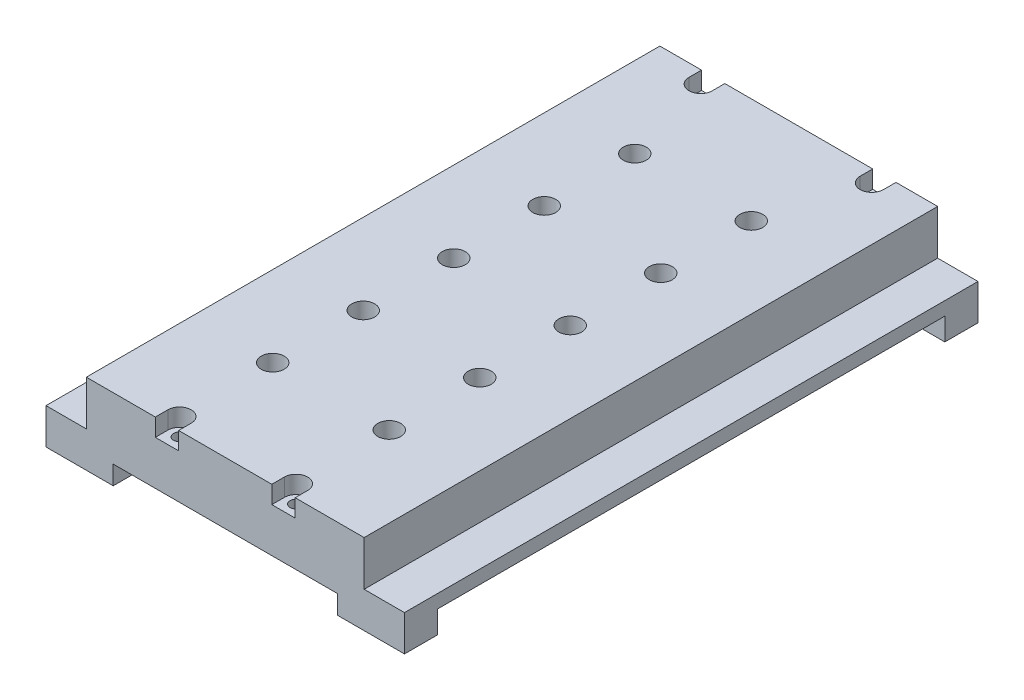
from build123d import *

# Parameters (mm, degrees)
SKETCH1_W                    = 101.6
SKETCH1_H                    = 162.56
BOSS_EXTRUDE1_DEPTH          = 22.86
SKETCH2_W                    = 75
SKETCH2_H                    = 150.368
CUT_EXTRUDE1_DEPTH           = 10.7
SKETCH3_W                    = 72
SKETCH3_H                    = 11.000000098
LPATTERN1_COUNT              = 6
LPATTERN1_PITCH              = 25.622799961
M3_CLEARANCE_HOLE1_D         = 3.4
SKETCH10_R                   = 3.249999977
CUT_EXTRUDE2_DEPTH           = 5
SKETCH11_W                   = 11.43
SKETCH11_H                   = 162.56
CUT_EXTRUDE3_DEPTH           = 12.7
SKETCH12_W                   = 15.748
SKETCH12_H                   = 143.764
CUT_EXTRUDE4_DEPTH           = 6.35
SKETCH17_W                   = 63.5
SKETCH17_H                   = 6.096
CUT_EXTRUDE6_DEPTH           = 5.334
M3_START                     = 5.334
M3_CLEARANCE_HOLE2_OUTLINE_R = 1.7
M3_CLEARANCE_HOLE2_DEPTH     = 17.526
CUT_EXTRUDE8_DEPTH           = 5


# Read off the part's stored shape, not the designer's step: M3 Clearance Hole2
with BuildPart() as part:
    # Sketch1 → Boss-Extrude1 (new body)
    with BuildSketch(Plane(origin=(0, 0, 0), x_dir=(1, 0, 0), z_dir=(0, 1, 0))):
        Rectangle(SKETCH1_W, SKETCH1_H)
    extrude(amount=BOSS_EXTRUDE1_DEPTH)

    # Sketch2 → Cut-Extrude1 (cut)
    with BuildSketch(Plane.XZ):
        Rectangle(SKETCH2_W, SKETCH2_H)
    extrude(amount=-CUT_EXTRUDE1_DEPTH, mode=Mode.SUBTRACT)

    # Sketch3 → Cut-Revolve3 (revolve, cut)
    with BuildSketch(Plane.XZ.offset(-10.7)):
        with Locations((0, 69.556999951)):
            Rectangle(SKETCH3_W, SKETCH3_H)
    cut_revolve3 = revolve(axis=Axis((-36, 10.7, 64.056999902), (1, 0, 0)), mode=Mode.SUBTRACT)

    # LPattern1: Cut-Revolve3 ×6
    with Locations(*[(0, 0, -i * LPATTERN1_PITCH) for i in range(1, LPATTERN1_COUNT)]):
        add(cut_revolve3, mode=Mode.SUBTRACT)

    # M3 Clearance Hole1 (through all)
    with Locations(Plane(origin=(0, 22.86, 0), x_dir=(1, 0, 0), z_dir=(0, 1, 0))):
        with Locations((-16.51, 51.308), (-16.51, 25.654), (-16.51, 0), (-16.51, -25.654), (-16.51, -51.308), (16.51, -51.308), (16.51, -25.654), (16.51, 0), (16.51, 25.654), (16.51, 51.308)):
            Hole(M3_CLEARANCE_HOLE1_D / 2)

    # Sketch10 → Cut-Extrude2 (cut)
    with BuildSketch(Plane(origin=(0, 22.86, 0), x_dir=(1, 0, 0), z_dir=(0, 1, 0))):
        with Locations(Location((-16.51, 51.308, 0), (0, 0, 270))):
            Circle(SKETCH10_R)
        with Locations(Location((-16.51, 25.654, 0), (0, 0, 270))):
            Circle(SKETCH10_R)
        with Locations(Location((-16.51, 0, 0), (0, 0, 270))):
            Circle(SKETCH10_R)
        with Locations(Location((-16.51, -25.654, 0), (0, 0, 270))):
            Circle(SKETCH10_R)
        with Locations(Location((-16.51, -51.308, 0), (0, 0, 270))):
            Circle(SKETCH10_R)
        with Locations(Location((16.51, -51.308, 0), (0, 0, 90))):
            Circle(SKETCH10_R)
        with Locations(Location((16.51, -25.654, 0), (0, 0, 90))):
            Circle(SKETCH10_R)
        with Locations(Location((16.51, 0, 0), (0, 0, 90))):
            Circle(SKETCH10_R)
        with Locations(Location((16.51, 25.654, 0), (0, 0, 90))):
            Circle(SKETCH10_R)
        with Locations(Location((16.51, 51.308, 0), (0, 0, 90))):
            Circle(SKETCH10_R)
    extrude(amount=-CUT_EXTRUDE2_DEPTH, mode=Mode.SUBTRACT)

    # Sketch11 → Cut-Extrude3 (cut)
    with BuildSketch(Plane(origin=(0, 22.86, 0), x_dir=(1, 0, 0), z_dir=(0, 1, 0))):
        with Locations((-45.085, 0)):
            Rectangle(SKETCH11_W, SKETCH11_H)
        with Locations((45.085, 0)):
            Rectangle(SKETCH11_W, SKETCH11_H)
    extrude(amount=-CUT_EXTRUDE3_DEPTH, mode=Mode.SUBTRACT)

    # Sketch12 → Cut-Extrude4 (cut)
    with BuildSketch(Plane.XZ):
        with Locations((-42.926, 0)):
            Rectangle(SKETCH12_W, SKETCH12_H)
        with Locations((42.926, 0)):
            Rectangle(SKETCH12_W, SKETCH12_H)
    extrude(amount=-CUT_EXTRUDE4_DEPTH, mode=Mode.SUBTRACT)

    # Sketch17 → Cut-Extrude6 (cut)
    with BuildSketch(Plane.XZ):
        with Locations((0, -78.232)):
            Rectangle(SKETCH17_W, SKETCH17_H)
        with Locations((0, 78.232)):
            Rectangle(SKETCH17_W, SKETCH17_H)
    extrude(amount=-CUT_EXTRUDE6_DEPTH, mode=Mode.SUBTRACT)

    # M3 Clearance Hole2 outline → M3 Clearance Hole2 (cut)
    with BuildSketch(Plane(origin=(0, 0, 0), x_dir=(1, 0, 0), z_dir=(0, 1, 0)).offset(M3_START)):
        with Locations((16.51, -77.724)):
            Circle(M3_CLEARANCE_HOLE2_OUTLINE_R)
        with Locations((-16.51, -77.724)):
            Circle(M3_CLEARANCE_HOLE2_OUTLINE_R)
        with Locations((24.257, 77.724)):
            Circle(M3_CLEARANCE_HOLE2_OUTLINE_R)
        with Locations((-24.257, 77.724)):
            Circle(M3_CLEARANCE_HOLE2_OUTLINE_R)
    extrude(amount=M3_CLEARANCE_HOLE2_DEPTH, mode=Mode.SUBTRACT)

    # Sketch21 → Cut-Extrude8 (cut)
    with BuildSketch(Plane(origin=(0, 22.86, 0), x_dir=(1, 0, 0), z_dir=(0, 1, 0))):
        with BuildLine():
            Line((-27.559, 77.724), (-27.559, 81.28))
            Line((-27.559, 81.28), (-20.955, 81.28))
            Line((-20.955, 81.28), (-20.955, 77.724))
            ThreePointArc((-20.955, 77.724), (-24.257, 74.422), (-27.559, 77.724))
        make_face()
        with BuildLine():
            Line((20.955, 77.724), (20.955, 81.28))
            Line((20.955, 81.28), (27.559, 81.28))
            Line((27.559, 81.28), (27.559, 77.724))
            ThreePointArc((27.559, 77.724), (24.257, 74.422), (20.955, 77.724))
        make_face()
        with BuildLine():
            Line((-19.812, -77.724), (-19.812, -81.28))
            Line((-19.812, -81.28), (-13.208, -81.28))
            Line((-13.208, -81.28), (-13.208, -77.724))
            ThreePointArc((-13.208, -77.724), (-16.51, -74.422), (-19.812, -77.724))
        make_face()
        with BuildLine():
            Line((13.208, -77.724), (13.208, -81.28))
            Line((13.208, -81.28), (19.812, -81.28))
            Line((19.812, -81.28), (19.812, -77.724))
            ThreePointArc((19.812, -77.724), (16.51, -74.422), (13.208, -77.724))
        make_face()
    extrude(amount=-CUT_EXTRUDE8_DEPTH, mode=Mode.SUBTRACT)


solid = part.part
